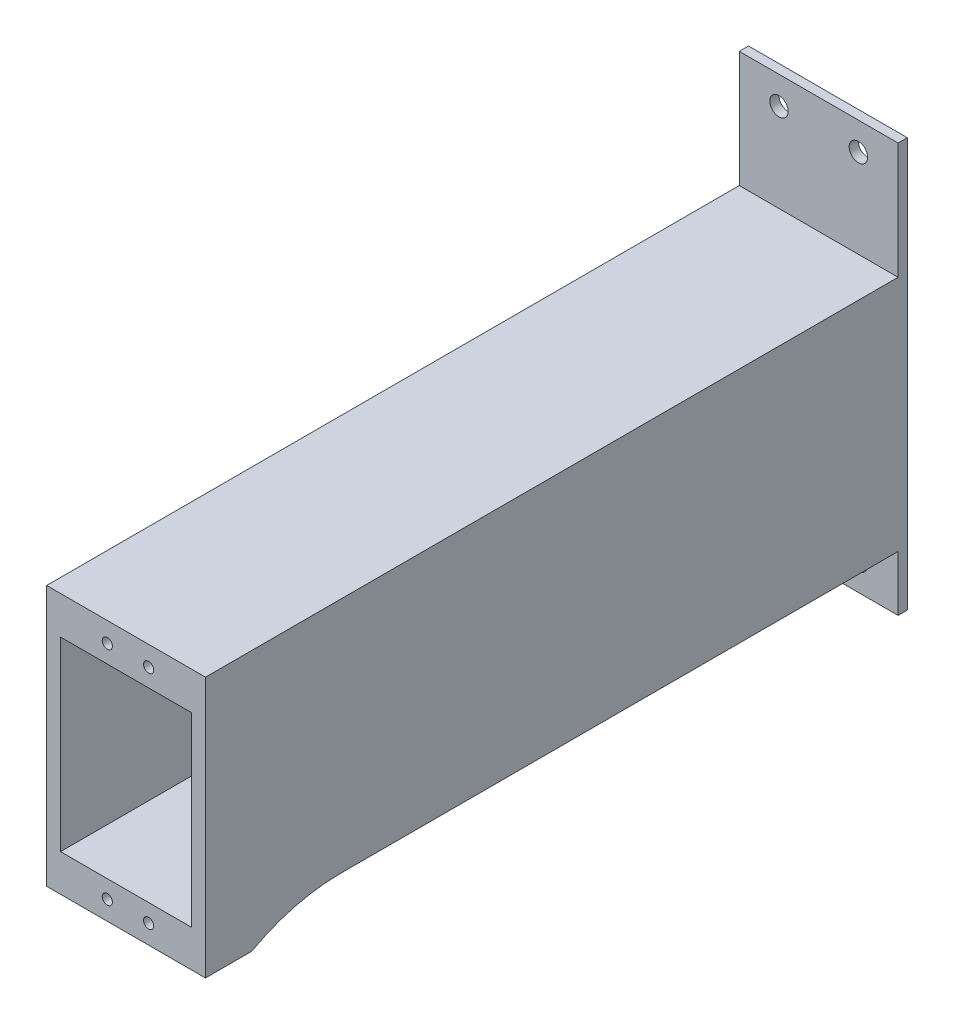
from build123d import *

# Parameters (mm, degrees)
SKETCH2_W           = 34.4
SKETCH2_H           = 88.6
BOSS_EXTRUDE1_DEPTH = 2
SKETCH5_R           = 2
CUT_EXTRUDE1_DEPTH  = 2
SKETCH8_W           = 28.4
SKETCH8_H           = 8.173290792
BOSS_EXTRUDE2_DEPTH = 150
SKETCH11_W          = 34.4
SKETCH11_H          = 5
BOSS_EXTRUDE4_DEPTH = 10
SKETCH12_R          = 1.1
CUT_EXTRUDE2_DEPTH  = 50
FILLET1_R           = 40


with BuildPart() as part:
    # Sketch2 → Boss-Extrude1 (new body)
    with BuildSketch(Plane.XY):
        with Locations((142.4072434, -76.6)):
            Rectangle(SKETCH2_W, SKETCH2_H)
    extrude(amount=BOSS_EXTRUDE1_DEPTH)

    # Sketch5 → Cut-Extrude1 (cut)
    with BuildSketch(Plane.XY.offset(2)):
        with Locations((151.0072434, -114.9)):
            Circle(SKETCH5_R)
        with Locations((133.8072434, -114.9)):
            Circle(SKETCH5_R)
        with Locations((133.8072434, -38.3)):
            Circle(SKETCH5_R)
        with Locations((151.0072434, -38.3)):
            Circle(SKETCH5_R)
    extrude(amount=-CUT_EXTRUDE1_DEPTH, mode=Mode.SUBTRACT)

    # Sketch8 → Boss-Extrude2 (add)
    with BuildSketch(Plane.XY.offset(2)):
        Polygon((125.2072434, -57.477141606), (125.2072434, -108.9), (159.6072434, -108.9), (159.6072434, -57.477141606), (156.6072434, -57.477141606), (156.6072434, -65.650432398), (156.6072434, -105.9), (128.2072434, -105.9), (128.2072434, -65.650432398), (128.2072434, -57.477141606), align=None)
        with Locations((142.4072434, -61.563787002)):
            Rectangle(SKETCH8_W, SKETCH8_H)
    extrude(amount=BOSS_EXTRUDE2_DEPTH)

    # Sketch11 → Boss-Extrude4 (add)
    with BuildSketch(Plane.XY.offset(152)):
        with Locations((142.4072434, -111.4)):
            Rectangle(SKETCH11_W, SKETCH11_H)
    extrude(amount=-BOSS_EXTRUDE4_DEPTH)

    # Sketch12 → Cut-Extrude2 (cut)
    with BuildSketch(Plane.XY.offset(152)):
        with Locations((138.33970051, -61.773162564)):
            Circle(SKETCH12_R)
        with Locations((147.28970051, -61.773162564)):
            Circle(SKETCH12_R)
        with Locations((138.33970051, -109.773162564)):
            Circle(SKETCH12_R)
        with Locations((147.28970051, -109.773162564)):
            Circle(SKETCH12_R)
    extrude(amount=-CUT_EXTRUDE2_DEPTH, mode=Mode.SUBTRACT)

    # Fillet1
    # the kernel refuses this fillet: 40 mm, written as the material it adds along each edge
    with BuildSketch(Plane(origin=(125.2072434, -108.9, 142), x_dir=(0, -1, 0), z_dir=(1, 0, 0))) as fillet1_piece_1_section:
        with BuildLine():
            CenterArc((40, 19.364916731), FILLET1_R, 180, 28.955024372)
            Line((0, 19.364916731), (-0.8, 19.364916731))
            Line((-0.8, 19.364916731), (-0.8, 0))
            Line((-0.8, 0), (0, -0.8))
            ThreePointArc((0, -0.8), (2.5, -0.8), (4.3, -0.387298335))
            Line((4.3, -0.387298335), (5, 0))
        make_face()
    fillet1_piece_1 = extrude(amount=60.875729403, mode=Mode.PRIVATE)
    fillet1_piece_1 = split(fillet1_piece_1, bisect_by=Plane(origin=(159.6072434, -109.845330822, 136.09364372), z_dir=(-1, 0, 0)), keep=Keep.TOP, mode=Mode.PRIVATE)
    fillet1_piece_1 = fillet1_piece_1 - Plane(origin=(147.28970051, -109.773162564, 136.09364372), x_dir=(1, 0, 0), z_dir=(0, 0, 1)) * Cylinder(1.1, 200, mode=Mode.PRIVATE)
    fillet1_piece_1 = fillet1_piece_1 - Plane(origin=(138.33970051, -109.773162564, 136.09364372), x_dir=(1, 0, 0), z_dir=(0, 0, 1)) * Cylinder(1.1, 200, mode=Mode.PRIVATE)
    add(fillet1_piece_1)


solid = part.part
